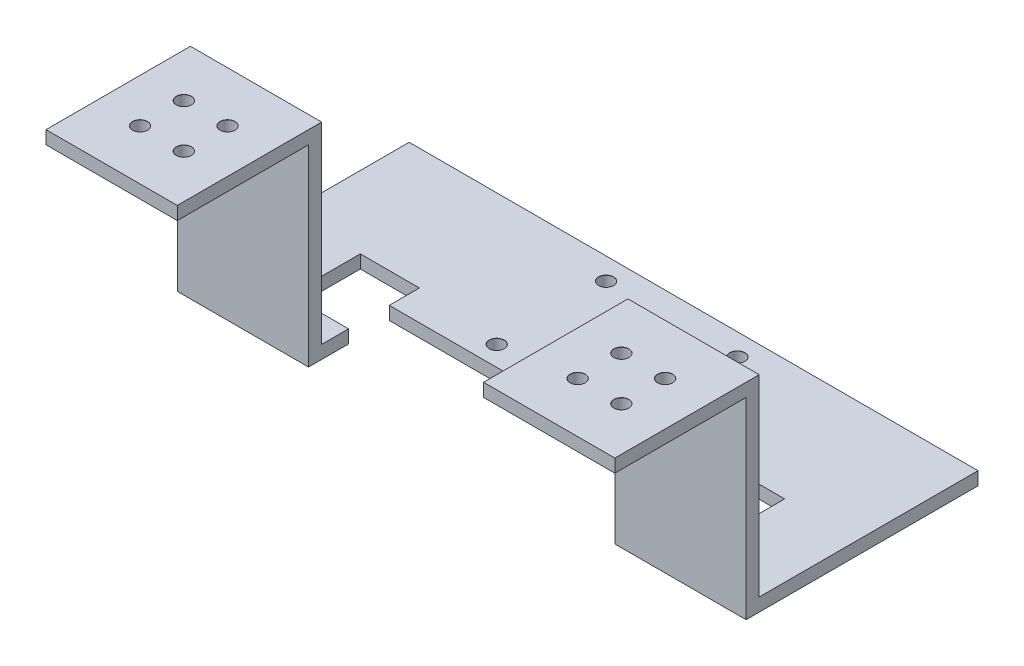
from build123d import *

# Parameters (mm, degrees)
BOSS_EXTRUDE1_DEPTH            = 130
SKETCH2_W                      = 70
SKETCH2_H                      = 43
CUT_EXTRUDE1_DEPTH             = 130
M3_CLEARANCE_HOLE1_D           = 3.4
M3_CLEARANCE_HOLE1_CSINK_D     = 3.45
M3_CLEARANCE_HOLE1_CSINK_ANGLE = 90
M3_CLEARANCE_HOLE2_D           = 3.4
M3_CLEARANCE_HOLE2_CSINK_D     = 3.45
M3_CLEARANCE_HOLE2_CSINK_ANGLE = 90
SKETCH7_W                      = 70
SKETCH7_H                      = 5.45
CUT_EXTRUDE2_DEPTH             = 10
SKETCH8_W                      = 13.495589791
SKETCH8_H                      = 16.176073109
CUT_EXTRUDE3_DEPTH             = 161.390149323


with BuildPart() as part:
    # Sketch1 → Boss-Extrude1 (new body)
    with BuildSketch(Plane(origin=(0, 0, 0), x_dir=(0, 0, -1), z_dir=(1, 0, 0))):
        Polygon((0, 44), (30, 44), (30, 0), (83, 0), (83, 3), (33, 3), (33, 47), (0, 47), align=None)
    extrude(amount=BOSS_EXTRUDE1_DEPTH)

    # Sketch2 → Cut-Extrude1 (cut)
    with BuildSketch(Plane(origin=(0, 47, 0), x_dir=(1, 0, 0), z_dir=(0, 1, 0))):
        with Locations((65, 21.5)):
            Rectangle(SKETCH2_W, SKETCH2_H)
    extrude(amount=-CUT_EXTRUDE1_DEPTH, mode=Mode.SUBTRACT)

    # M3 Clearance Hole1 (through all)
    with Locations(Plane(origin=(0, 47, 0), x_dir=(1, 0, 0), z_dir=(0, 1, 0))):
        with Locations((120, 11.5), (10, 21.5), (20, 21.5), (10, 11.5), (20, 11.5), (120, 21.5), (110, 21.5), (110, 11.5)):
            CounterSinkHole(M3_CLEARANCE_HOLE1_D / 2, M3_CLEARANCE_HOLE1_CSINK_D / 2, counter_sink_angle=M3_CLEARANCE_HOLE1_CSINK_ANGLE)

    # M3 Clearance Hole2 (through all)
    with Locations(Plane(origin=(0, 3, 0), x_dir=(1, 0, 0), z_dir=(0, 1, 0))):
        with Locations((80, 53), (50, 78), (80, 78), (50, 53)):
            CounterSinkHole(M3_CLEARANCE_HOLE2_D / 2, M3_CLEARANCE_HOLE2_CSINK_D / 2, counter_sink_angle=M3_CLEARANCE_HOLE2_CSINK_ANGLE)

    # Sketch7 → Cut-Extrude2 (cut)
    with BuildSketch(Plane(origin=(0, 3, 0), x_dir=(1, 0, 0), z_dir=(0, 1, 0))):
        with Locations((65, 45.725)):
            Rectangle(SKETCH7_W, SKETCH7_H)
    extrude(amount=-CUT_EXTRUDE2_DEPTH, mode=Mode.SUBTRACT)

    # Sketch8 → Cut-Extrude3 (cut, through all)
    with BuildSketch(Plane(origin=(0, 3, 0), x_dir=(1, 0, 0), z_dir=(0, 1, 0))):
        with Locations((106.747794895, 47.238838103)):
            Rectangle(SKETCH8_W, SKETCH8_H)
        with Locations((23.252205104, 47.238838103)):
            Rectangle(SKETCH8_W, SKETCH8_H)
    extrude(amount=-CUT_EXTRUDE3_DEPTH, mode=Mode.SUBTRACT)


solid = part.part
